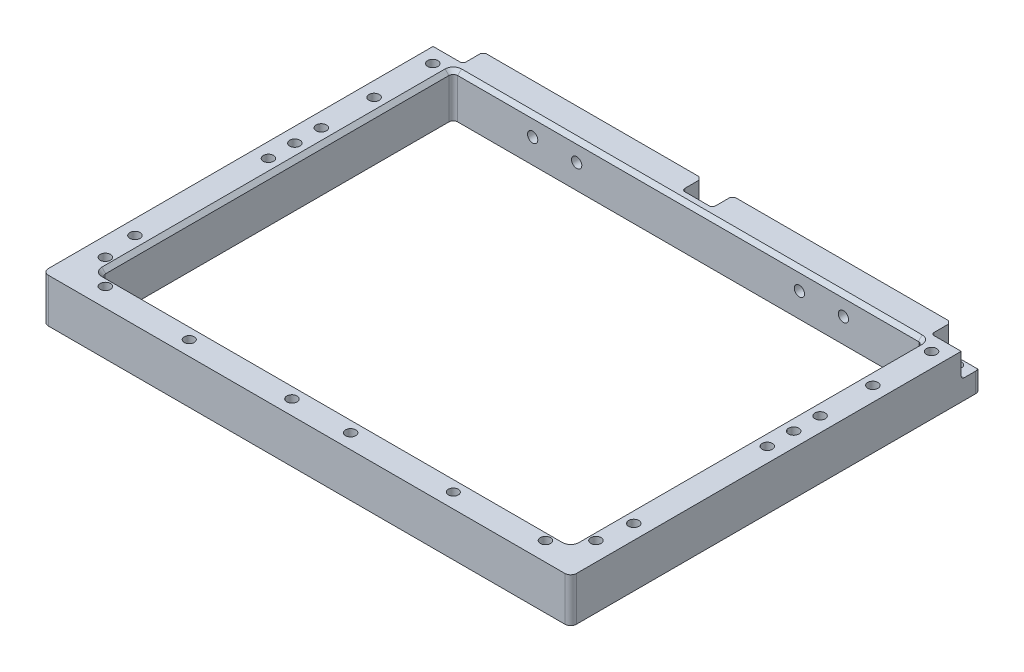
from build123d import *

# Parameters (mm, degrees)
SKETCH1_W                    = 228.6
SKETCH1_H                    = 177.8
SKETCH1_W_2                  = 203.2
SKETCH1_H_2                  = 152.4
BOSS_EXTRUDE1_DEPTH          = 19.05
SKETCH2_W                    = 12.954
SKETCH2_H                    = 10.541
SKETCH2_W_2                  = 13.208
CUT_EXTRUDE1_DEPTH           = 8.763
SKETCH3_R                    = 2.2225
FRONT_BASE_MOUNTHOLES_DEPTH  = 7.112
FILLET2_R                    = 1.27
CHAMFER1_SIZE                = 1.27
SKETCH4_R                    = 2.2225
FRONT_BASE_MOUNTHOLES2_DEPTH = 7.62
SKETCH5_R                    = 2.2225
REAR_WALL_MOUNTHOLES_DEPTH   = 7.62
FILLET3_R                    = 1.905
SKETCH6_R                    = 2.2225
MOTOR_MOUNT_HOLES_DEPTH      = 7.62
CHAMFER2_SIZE                = 1.651
SKETCH7_R                    = 2.2225
REARBRACE_MOUNTHOLES_DEPTH   = 7.62
SKETCH8_R                    = 2.2225
SIDEBRACE_MOUNTHOLES_DEPTH   = 7.112
SKETCH9_R                    = 2.159
BATTERYMOUNT_HOLES_DEPTH     = 8.89
FILLET4_R                    = 2.54
SKETCH10_R                   = 2.2225
MOTOR_BRACE_MOUNTHOLES_DEPTH = 5.588


with BuildPart() as part:
    # Sketch1 → Boss-Extrude1 (new body)
    with BuildSketch(Plane(origin=(0, 0, 0), x_dir=(1, 0, 0), z_dir=(0, 1, 0))):
        Rectangle(SKETCH1_W, SKETCH1_H)
        Rectangle(SKETCH1_W_2, SKETCH1_H_2, mode=Mode.SUBTRACT)
    extrude(amount=BOSS_EXTRUDE1_DEPTH)

    # Sketch2 → Cut-Extrude1 (cut)
    with BuildSketch(Plane(origin=(0, 0, -88.9), x_dir=(-1, 0, 0), z_dir=(0, 0, -1))):
        with Locations((107.823, 13.7795)):
            Rectangle(SKETCH2_W, SKETCH2_H)
        with Locations((0, 13.7795)):
            Rectangle(SKETCH2_W_2, SKETCH2_H)
        with Locations((-107.823, 13.7795)):
            Rectangle(SKETCH2_W, SKETCH2_H)
    extrude(amount=-CUT_EXTRUDE1_DEPTH, mode=Mode.SUBTRACT)

    # Sketch3 → Front-Base-MountHoles (cut)
    with BuildSketch(Plane(origin=(0, 8.509, 0), x_dir=(1, 0, 0), z_dir=(0, 1, 0))):
        with Locations((-107.823, 84.5185)):
            Circle(SKETCH3_R)
        with Locations((0, 84.5185)):
            Circle(SKETCH3_R)
        with Locations((107.823, 84.5185)):
            Circle(SKETCH3_R)
    extrude(amount=-FRONT_BASE_MOUNTHOLES_DEPTH, mode=Mode.SUBTRACT)

    # Fillet2
    fillet2_edges = [part.edges().sort_by_distance(p)[0] for p in [
        (101.346, 8.509, -84.5185),
        (107.823, 8.509, -80.137),
        (-6.604, 8.509, -84.5185),
        (0, 8.509, -80.137),
        (6.604, 8.509, -84.5185),
        (-107.823, 8.509, -80.137),
        (-101.346, 8.509, -84.5185),
        (-101.346, 13.7795, -80.137),
        (-6.604, 13.7795, -80.137),
        (6.604, 13.7795, -80.137),
        (101.346, 13.7795, -80.137),
    ]]
    fillet(fillet2_edges, radius=FILLET2_R)

    # Chamfer1
    chamfer1_edges = [part.edges().sort_by_distance(p)[0] for p in [
        (-108.458, 8.509, -88.9),
        (-101.717974388, 8.880974388, -88.9),
        (-101.346, 14.4145, -88.9),
        (-6.604, 14.4145, -88.9),
        (-6.232025612, 8.880974388, -88.9),
        (0, 8.509, -88.9),
        (6.232025612, 8.880974388, -88.9),
        (6.604, 14.4145, -88.9),
        (108.458, 8.509, -88.9),
        (101.717974388, 8.880974388, -88.9),
        (101.346, 14.4145, -88.9),
    ]]
    chamfer(chamfer1_edges, length=CHAMFER1_SIZE)

    # Sketch4 → Front-base-MountHoles2 (cut)
    with BuildSketch(Plane(origin=(0, 0, -88.9), x_dir=(-1, 0, 0), z_dir=(0, 0, -1))):
        with Locations((-20.32, 9.525)):
            Circle(SKETCH4_R)
        with Locations((-81.28, 9.525)):
            Circle(SKETCH4_R)
        with Locations((81.28, 9.525)):
            Circle(SKETCH4_R)
        with Locations((20.32, 9.525)):
            Circle(SKETCH4_R)
    extrude(amount=-FRONT_BASE_MOUNTHOLES2_DEPTH, mode=Mode.SUBTRACT)

    # Sketch5 → Rear-Wall-MountHoles (cut)
    with BuildSketch(Plane(origin=(0, 19.05, 0), x_dir=(1, 0, 0), z_dir=(0, 1, 0))):
        with Locations((-95.25, -80.772)):
            Circle(SKETCH5_R)
        with Locations((-106.172, -69.85)):
            Circle(SKETCH5_R)
        with Locations((106.172, -69.85)):
            Circle(SKETCH5_R)
        with Locations((95.25, -80.772)):
            Circle(SKETCH5_R)
    extrude(amount=-REAR_WALL_MOUNTHOLES_DEPTH, mode=Mode.SUBTRACT)

    # Fillet3
    fillet3_edges = [part.edges().sort_by_distance(p)[0] for p in [
        (-101.6, 9.525, 76.2),
        (101.6, 9.525, 76.2),
        (101.6, 9.525, -76.2),
        (-101.6, 9.525, -76.2),
    ]]
    fillet(fillet3_edges, radius=FILLET3_R)

    # Sketch6 → Motor_Mount_Holes (cut)
    with BuildSketch(Plane(origin=(0, 19.05, 0), x_dir=(1, 0, 0), z_dir=(0, 1, 0))):
        with Locations((107.95, -55.245)):
            Circle(SKETCH6_R)
        with Locations((107.95, 2.54)):
            Circle(SKETCH6_R)
        with Locations((107.95, 13.97)):
            Circle(SKETCH6_R)
        with Locations((107.95, 25.4)):
            Circle(SKETCH6_R)
        with Locations((-107.95, 25.4)):
            Circle(SKETCH6_R)
        with Locations((-107.95, 13.97)):
            Circle(SKETCH6_R)
        with Locations((-107.95, 2.54)):
            Circle(SKETCH6_R)
        with Locations((-107.95, -55.245)):
            Circle(SKETCH6_R)
    extrude(amount=-MOTOR_MOUNT_HOLES_DEPTH, mode=Mode.SUBTRACT)

    # Chamfer2
    chamfer2_edges = [part.edges().sort_by_distance(p)[0] for p in [
        (-101.6, 19.05, 0),
        (-101.042038418, 19.05, 75.642038418),
        (-101.042038418, 19.05, -75.642038418),
        (0, 19.05, 76.2),
        (0, 19.05, -76.2),
        (101.042038418, 19.05, 75.642038418),
        (101.042038418, 19.05, -75.642038418),
        (101.6, 19.05, 0),
    ]]
    chamfer(chamfer2_edges, length=CHAMFER2_SIZE)

    # Sketch7 → RearBrace_MountHoles (cut)
    with BuildSketch(Plane(origin=(0, 19.05, 0), x_dir=(1, 0, 0), z_dir=(0, 1, 0))):
        with Locations((-12.7, -82.55)):
            Circle(SKETCH7_R)
        with Locations((12.7, -82.55)):
            Circle(SKETCH7_R)
    extrude(amount=-REARBRACE_MOUNTHOLES_DEPTH, mode=Mode.SUBTRACT)

    # Sketch8 → SideBrace_MountHoles (cut)
    with BuildSketch(Plane(origin=(0, 19.05, 0), x_dir=(1, 0, 0), z_dir=(0, 1, 0))):
        with Locations((107.95, 73.66)):
            Circle(SKETCH8_R)
        with Locations((107.95, 48.26)):
            Circle(SKETCH8_R)
        with Locations((-107.95, 48.26)):
            Circle(SKETCH8_R)
        with Locations((-107.95, 73.66)):
            Circle(SKETCH8_R)
    extrude(amount=-SIDEBRACE_MOUNTHOLES_DEPTH, mode=Mode.SUBTRACT)

    # Sketch9 → BatteryMount_Holes (cut)
    with BuildSketch(Plane(origin=(0, 19.05, 0), x_dir=(1, 0, 0), z_dir=(0, 1, 0))):
        with Locations((-57.15, -82.55)):
            Circle(SKETCH9_R)
        with Locations((57.15, -82.55)):
            Circle(SKETCH9_R)
    extrude(amount=-BATTERYMOUNT_HOLES_DEPTH, mode=Mode.SUBTRACT)

    # Fillet4
    fillet4_edges = [part.edges().sort_by_distance(p)[0] for p in [
        (-114.3, 3.6195, -88.9),
        (114.3, 3.6195, -88.9),
        (-114.3, 9.525, 88.9),
        (114.3, 9.525, 88.9),
    ]]
    fillet(fillet4_edges, radius=FILLET4_R)

    # Sketch10 → Motor-Brace-MountHoles (cut)
    with BuildSketch(Plane.XY.offset(-76.2)):
        with Locations((48.20666, 10.541)):
            Circle(SKETCH10_R)
        with Locations((67.25666, 10.541)):
            Circle(SKETCH10_R)
        with Locations((-67.25666, 10.541)):
            Circle(SKETCH10_R)
        with Locations((-48.20666, 10.541)):
            Circle(SKETCH10_R)
    extrude(amount=-MOTOR_BRACE_MOUNTHOLES_DEPTH, mode=Mode.SUBTRACT)


solid = part.part
